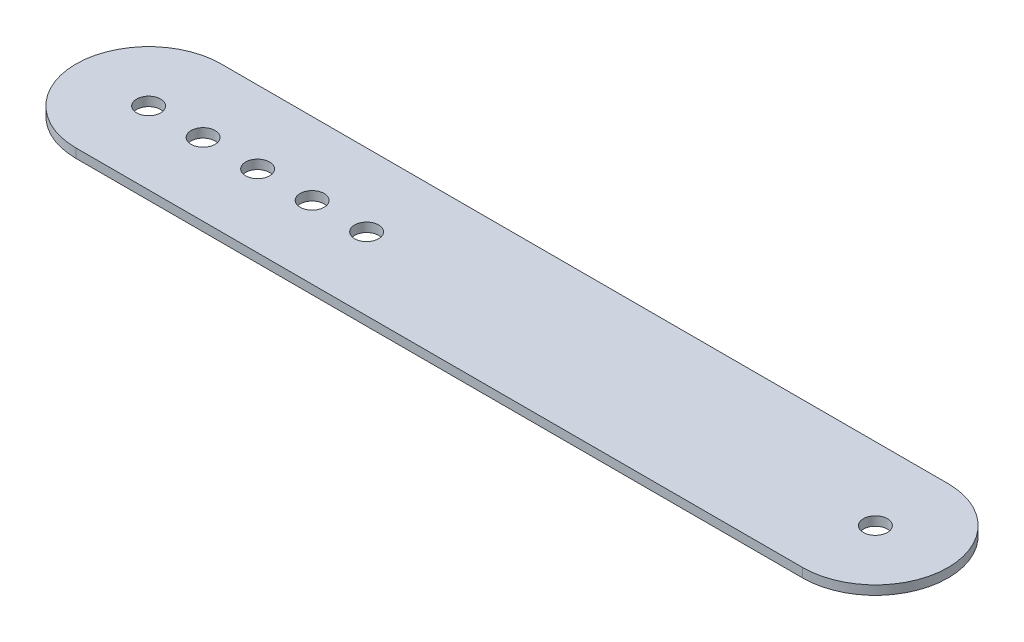
from build123d import *

# Parameters (mm, degrees)
BOSS_EXTRUDE1_DEPTH = 3.175
SKETCH3_R           = 4.191
CUT_EXTRUDE1_DEPTH  = 281.570134948
LPATTERN1_OUTLINE_R = 4.191
LPATTERN1_DEPTH     = 3.175


# Read off the part's stored shape, not the designer's step: LPattern1
with BuildPart() as part:
    # Sketch1 → Boss-Extrude1 (new body)
    with BuildSketch(Plane(origin=(0, 0, 0), x_dir=(1, 0, 0), z_dir=(0, 1, 0))):
        with BuildLine():
            Line((0, 25.4), (-254, 25.4))
            ThreePointArc((-254, 25.4), (-279.4, 0), (-254, -25.4))
            Line((-254, -25.4), (0, -25.4))
            ThreePointArc((0, -25.4), (25.4, 0), (0, 25.4))
        make_face()
    extrude(amount=BOSS_EXTRUDE1_DEPTH)

    # Sketch3 → Cut-Extrude1 (cut, through all)
    with BuildSketch(Plane(origin=(0, 3.175, 0), x_dir=(1, 0, 0), z_dir=(0, 1, 0))):
        with Locations(Location((0, 0, 0), (0, 0, 270))):
            Circle(SKETCH3_R)
        with Locations(Location((-254, 0, 0), (0, 0, 270))):
            Circle(SKETCH3_R)
    extrude(amount=-CUT_EXTRUDE1_DEPTH, mode=Mode.SUBTRACT)

    # LPattern1 outline → LPattern1 (cut)
    with BuildSketch(Plane(origin=(0, 0, 0), x_dir=(1, 0, 0), z_dir=(0, 1, 0))):
        with Locations((-177.8, 0)):
            Circle(LPATTERN1_OUTLINE_R)
        with Locations((-196.85, 0)):
            Circle(LPATTERN1_OUTLINE_R)
        with Locations((-215.9, 0)):
            Circle(LPATTERN1_OUTLINE_R)
        with Locations((-234.95, 0)):
            Circle(LPATTERN1_OUTLINE_R)
    extrude(amount=LPATTERN1_DEPTH, mode=Mode.SUBTRACT)


solid = part.part
